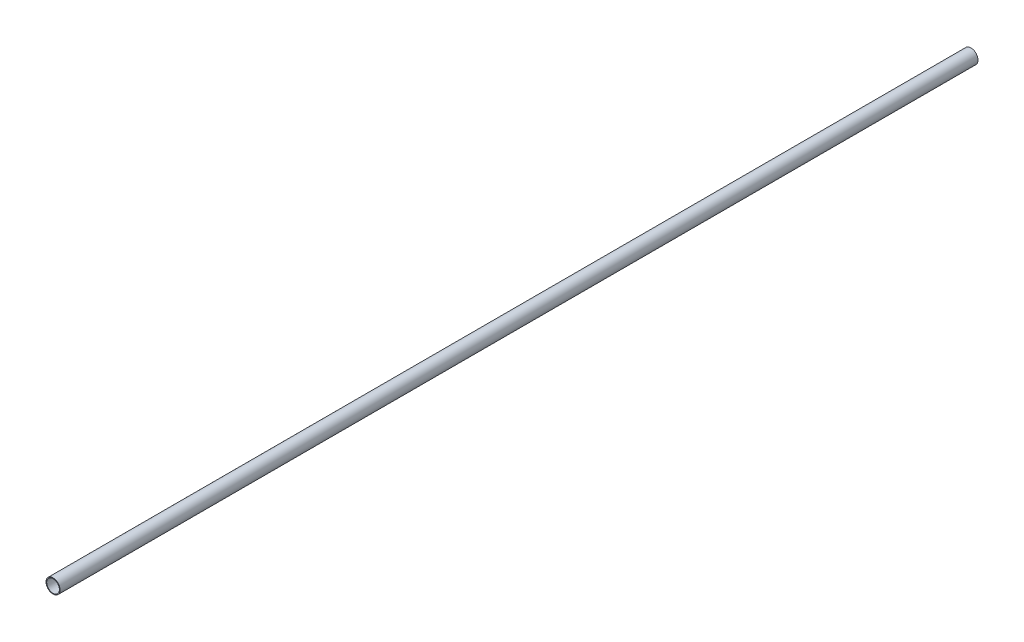
from build123d import *

# Parameters (mm, degrees)
SKETCH_1_R      = 10
SKETCH_1_R_2    = 9
EXTRUDE_1_DEPTH = 650


with BuildPart() as part:
    # Эскиз1 → Бобышка-Вытянуть1 (new, symmetric)
    with BuildSketch(Plane.XY):
        Circle(SKETCH_1_R)
        Circle(SKETCH_1_R_2, mode=Mode.SUBTRACT)
    extrude(amount=EXTRUDE_1_DEPTH, both=True)


solid = part.part
